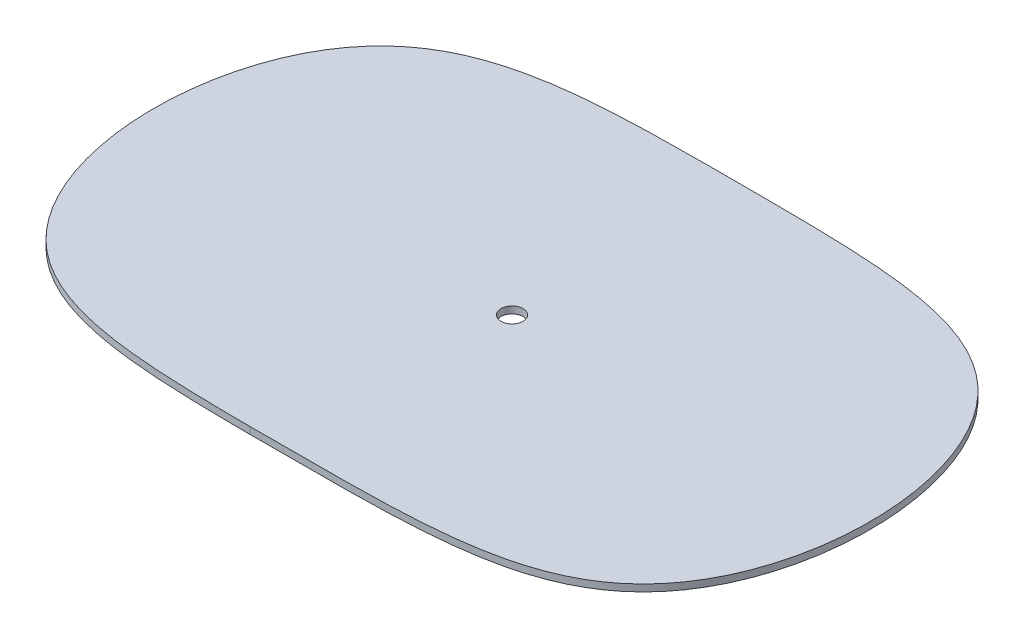
from build123d import *

# Parameters (mm, degrees)
BOSS_EXTRUDE1_DEPTH = 3
SKETCH2_R           = 4.8
CUT_EXTRUDE1_DEPTH  = 198.523459883


with BuildPart() as part:
    # Sketch1 → Boss-Extrude1 (new body)
    with BuildSketch(Plane(origin=(0, 0, 0), x_dir=(1, 0, 0), z_dir=(0, 1, 0))):
        with BuildLine():
            add(Edge.make_bspline(
                [(-30, 99.06698467), (-32.532735779, 99.056001025), (-37.61328617, 99.025603214), (-47.653119378, 98.91255969), (-60.017920516, 98.632069436), (-74.412680935, 97.90936234), (-92.831035015, 96.179269116), (-109.717564439, 92.87555883), (-124.28677995, 87.3896812), (-133.975576668, 82.124889634), (-142.488698326, 75.631349334), (-152.406438171, 65.231954534), (-162.182142303, 48.871169633), (-169.289461931, 25.320194156), (-171.640940241, 1.3009e-05), (-169.289418722, -25.32029427), (-162.18227802, -48.870881186), (-152.406242098, -65.232254062), (-142.488106838, -75.631961676), (-133.976382336, -82.123911969), (-124.287777486, -87.389835297), (-109.713936244, -92.876408619), (-92.830856323, -96.179247606), (-74.413200221, -97.909351647), (-60.017617256, -98.632073024), (-47.653236885, -98.912525865), (-37.61306022, -99.025621971), (-32.532689832, -99.056054425), (-30, -99.067042506)],
                knots=[0.05431338, 0.05431338, 0.05431338, 0.05431338, 0.068241086, 0.082168792, 0.110024205, 0.137879617, 0.165735029, 0.221445853, 0.249301265, 0.277156677, 0.305012089, 0.332867501, 0.388578326, 0.44428915, 0.499999974, 0.555710798, 0.611421623, 0.667132447, 0.694987859, 0.722843271, 0.750698683, 0.778554095, 0.83426492, 0.862120332, 0.889975744, 0.917831156, 0.931758862, 0.945686568, 0.945686568, 0.945686568, 0.945686568], degree=3))
            add(Edge.make_bspline(
                [(-30, -99.067042506), (-24.231523801, -99.067042563), (-12.665950369, -99.070007228), (10.236225257, -99.023538155), (38.134310873, -98.594171749), (63.923854379, -96.144936786), (82.248904827, -91.858206527), (94.559349211, -87.293946328), (105.305565897, -81.274379358), (114.588260882, -73.70003472), (122.544971898, -64.451357532), (131.371968317, -49.952266967), (138.829821866, -28.402610508), (141.787028653, 0.00110072), (138.829216843, 28.404926855), (131.371512214, 49.953541724), (122.543410139, 64.45336638), (111.936489783, 76.78313869), (98.660855387, 85.772764277), (82.249129826, 91.858038066), (63.920493872, 96.145824931), (38.13142653, 98.594061847), (10.23469883, 99.023533128), (-12.670616054, 99.069799498), (-24.232653599, 99.067533343), (-30, 99.06698467)],
                knots=[-5.145e-06, -5.145e-06, -5.145e-06, -5.145e-06, 0.031245016, 0.062495177, 0.124995498, 0.18749582, 0.218745981, 0.249996141, 0.281246302, 0.312496463, 0.343746624, 0.374996784, 0.437497106, 0.499997428, 0.562497749, 0.624998071, 0.656248231, 0.687498392, 0.749998714, 0.781248875, 0.812499035, 0.874999357, 0.937499678, 0.968749839, 1, 1, 1, 1], degree=3))
        make_face()
    extrude(amount=BOSS_EXTRUDE1_DEPTH)

    # Sketch2 → Cut-Extrude1 (cut, through all)
    with BuildSketch(Plane(origin=(0, 0, 0), x_dir=(1, 0, 0), z_dir=(0, 1, 0))):
        with Locations((-15.027957355, 0)):
            Circle(SKETCH2_R)
    extrude(amount=CUT_EXTRUDE1_DEPTH, mode=Mode.SUBTRACT)


solid = part.part
